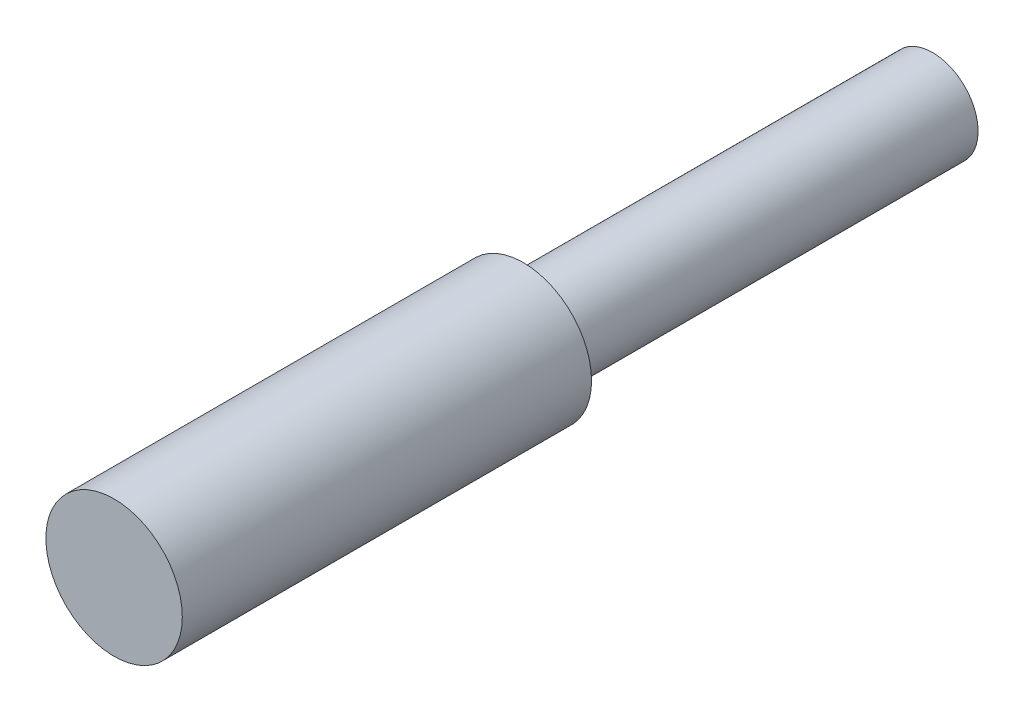
from build123d import *

# Parameters (mm, degrees)
SKETCH1_R           = 3
BOSS_EXTRUDE1_DEPTH = 18
SKETCH2_R           = 2
BOSS_EXTRUDE2_DEPTH = 18


with BuildPart() as part:
    # Sketch1 → Boss-Extrude1 (new body)
    with BuildSketch(Plane.XY):
        Circle(SKETCH1_R)
    extrude(amount=BOSS_EXTRUDE1_DEPTH)

    # Sketch2 → Boss-Extrude2 (add)
    with BuildSketch(Plane(origin=(0, 0, 0), x_dir=(-1, 0, 0), z_dir=(0, 0, -1))):
        Circle(SKETCH2_R)
    extrude(amount=BOSS_EXTRUDE2_DEPTH)


solid = part.part
